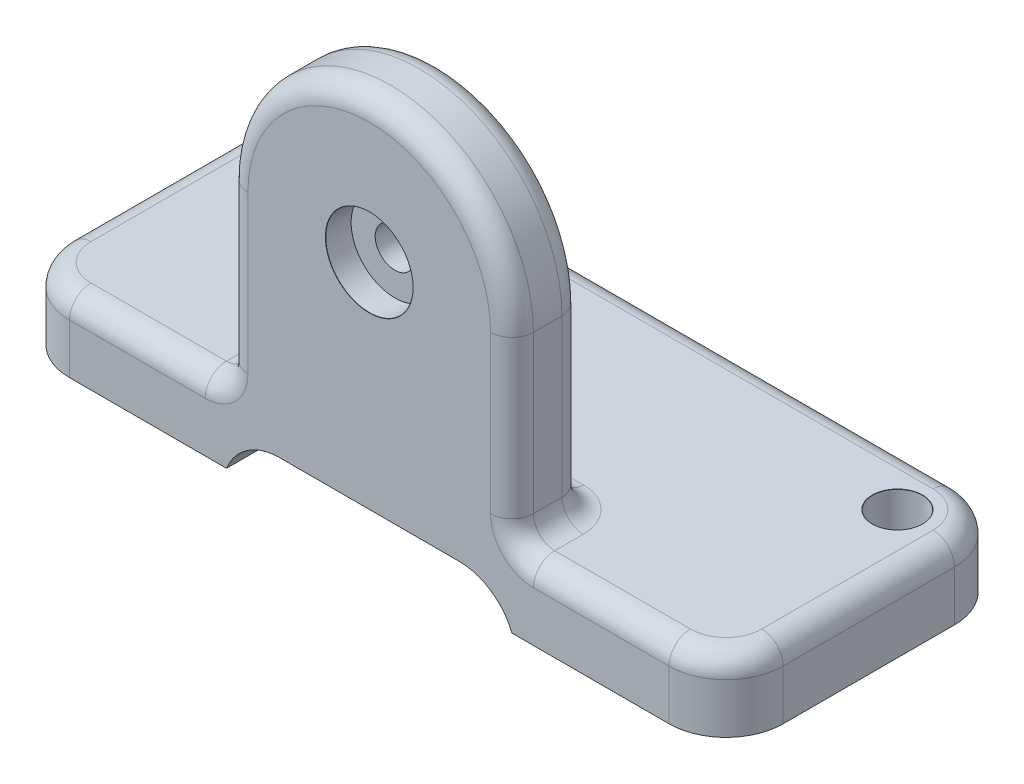
from build123d import *

# Parameters (mm, degrees)
ESBO_O1_W                            = 100
ESBO_O1_H                            = 40
RESSALTO_EXTRUS_O1_DEPTH             = 10
RESSALTO_EXTRUS_O2_DEPTH             = 10
ESBO_O4_W                            = 40
ESBO_O4_H                            = 5.013946539
CORTE_EXTRUS_O1_DEPTH                = 121.933866224
FILETE1_R                            = 8
FURO_DE_DI_METRO_7_0_7_1_D           = 7
FURO_DE_DI_METRO_7_0_7_1_CSINK_D     = 7.05
FURO_DE_DI_METRO_7_0_7_1_CSINK_ANGLE = 90
FILETE2_R                            = 3


with BuildPart() as part:
    # Esboço1 → Ressalto-extrusão1 (new body)
    with BuildSketch(Plane(origin=(0, 0, 0), x_dir=(1, 0, 0), z_dir=(0, 1, 0))):
        with Locations((50, 20)):
            Rectangle(ESBO_O1_W, ESBO_O1_H)
    extrude(amount=RESSALTO_EXTRUS_O1_DEPTH)

    # Esboço3 → Ressalto-extrusão2 (add)
    with BuildSketch(Plane.XY):
        with BuildLine():
            Line((30, 0), (30, 35))
            ThreePointArc((30, 35), (50, 55), (70, 35))
            Line((70, 35), (70, 0))
            Line((70, 0), (30, 0))
        make_face()
    extrude(amount=-RESSALTO_EXTRUS_O2_DEPTH)

    # Esboço4 → Corte-extrusão1 (cut, through all)
    with BuildSketch(Plane.XY):
        with Locations((50, 2.506973269)):
            Rectangle(ESBO_O4_W, ESBO_O4_H)
    extrude(amount=-CORTE_EXTRUS_O1_DEPTH, mode=Mode.SUBTRACT)

    # Esboço6 → Rebaixo para parafuso de cabeça sextavada de M51 (revolve, cut)
    with BuildSketch(Plane(origin=(50, 35, 0), x_dir=(0, -1, 0), z_dir=(1, 0, 0))):
        Polygon((0, 0), (0, 40), (2.75, 40), (2.75, 3.58), (6.12, 3.58), (6.12, 0.025), (6.145, 0), align=None)
    revolve(axis=Axis((50, 35, 6.35), (0, 0, -1)), mode=Mode.SUBTRACT)

    # Filete1
    # the kernel refuses this fillet: 8 mm, written as the material it adds along each edge
    with BuildSketch(Plane(origin=(70, 5.013946539, 0), x_dir=(-1, 0, 0), z_dir=(0, 0, -1))) as filete1_piece_1:
        with BuildLine():
            CenterArc((7.421824892, -8), FILETE1_R, 90, 68.083393909)
            Line((0, -5.013946539), (0, 0))
            Line((0, 0), (7.421824892, 0))
        make_face()
    extrude(amount=40)
    with BuildSketch(Plane(origin=(30, 5.013946539, 0), x_dir=(0, -1, 0), z_dir=(0, 0, -1))) as filete1_piece_2:
        with BuildLine():
            CenterArc((8, -7.421824892), FILETE1_R, 111.916606091, 68.083393909)
            Line((0, -7.421824892), (0, 0))
            Line((0, 0), (5.013946539, 0))
        make_face()
    extrude(amount=40)
    # the kernel refuses this fillet: 8 mm, written as the material it takes off along each edge
    with BuildSketch(Plane(origin=(0, -20, -40), x_dir=(0, 0, 1), z_dir=(0, 1, 0)), Plane(origin=(0, -20, 0), x_dir=(1, 0, 0), z_dir=(0, 1, 0))) as filete1_2_piece_1:
        with BuildLine():
            CenterArc((FILETE1_R, FILETE1_R), FILETE1_R, 180, 90)
            Line((0, FILETE1_R), (0, 0))
            Line((0, 0), (FILETE1_R, 0))
        make_face()
    extrude(amount=50, mode=Mode.SUBTRACT)
    with BuildSketch(Plane(origin=(100, -20, -40), x_dir=(0, 0, 1), z_dir=(0, 1, 0)), Plane(origin=(100, -20, 0), x_dir=(-1, 0, 0), z_dir=(0, 1, 0))) as filete1_2_piece_2:
        with BuildLine():
            CenterArc((FILETE1_R, -FILETE1_R), FILETE1_R, 90, 90)
            Line((0, -FILETE1_R), (0, 0))
            Line((0, 0), (FILETE1_R, 0))
        make_face()
    extrude(amount=50, mode=Mode.SUBTRACT)

    # Furo de diâmetro Ø7.0 (7)1 (through all)
    with Locations(Plane(origin=(0, 10, 0), x_dir=(1, 0, 0), z_dir=(0, 1, 0))):
        with Locations((8, 32), (92, 32)):
            CounterSinkHole(FURO_DE_DI_METRO_7_0_7_1_D / 2, FURO_DE_DI_METRO_7_0_7_1_CSINK_D / 2, counter_sink_angle=FURO_DE_DI_METRO_7_0_7_1_CSINK_ANGLE)

    # Filete2
    filete2_edges = [part.edges().sort_by_distance(p)[0] for p in [
        (81, 10, 0),
        (30, 22.5, -10),
        (70, 22.5, -10),
        (30, 22.5, 0),
        (70, 22.5, 0),
        (50, 55, 0),
        (30, 10, -5),
        (50, 55, -10),
        (70, 10, -5),
        (50, 10, -10),
        (0, 10, -20),
        (50, 10, -40),
        (19, 10, 0),
        (100, 10, -20),
        (97.656854249, 10, -2.343145751),
        (97.656854249, 10, -37.656854249),
        (2.343145751, 10, -2.343145751),
        (2.343145751, 10, -37.656854249),
    ]]
    fillet(filete2_edges, radius=FILETE2_R)


solid = part.part
